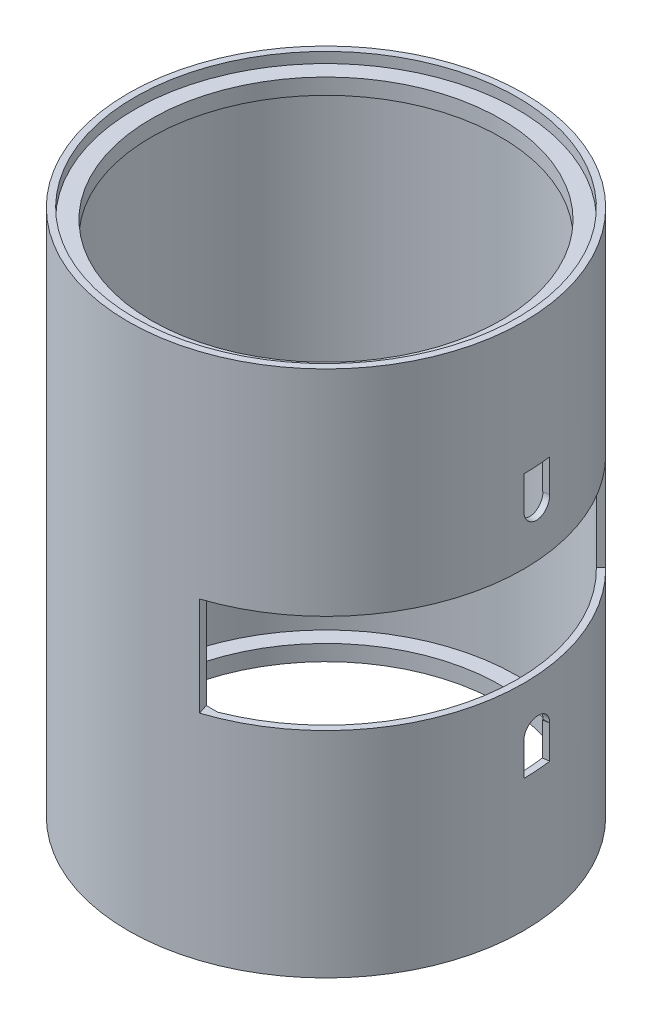
from build123d import *

# Parameters (mm, degrees)
EXTRUDE_11_REACH             = 60.31
EXTRUDE_11_DIRECTION_2_REACH = 60.31
CUT_EXTRUDE_1_DEPTH          = 7.5
CUT_EXTRUDE_1_DEPTH_BACK     = 7.5
CUT_EXTRUDE_2_DEPTH          = 5
CUT_EXTRUDE_START            = 28.688718626
CUT_EXTRUDE_3_DEPTH          = 1.311276176


# Read off the part's stored shape, not the designer's step: 切除-拉伸3
with BuildPart() as part:
    # 草图1 → 旋转1 (revolve)
    with BuildSketch(Plane.XY, mode=Mode.PRIVATE) as revolve_1_sk:
        Polygon((26.5, 38.4), (26.5, 36), (29, 36), (29, 0), (30, 0), (30, 40), (29, 40), (29, 38.4), align=None)
    revolve_1 = revolve(revolve_1_sk.sketch.rotate(Axis((0, 66, 0), (0, -1, 0)), 90), axis=Axis((0, 66, 0), (0, -1, 0)))

    # 镜向1: 旋转1 across plane
    add(revolve_1.mirror(Plane.ZX))

    # 凸台-拉伸11: up to this face of the body (flat: up to its plane)
    extrude_11_end = Plane(part.part.faces().sort_by_distance((0, 36, -27.320243866))[0])
    # 草图11 → 凸台-拉伸11 (add, up to the picked face)
    with BuildSketch(Plane(origin=(0, 0, 0), x_dir=(1, 0, 0), z_dir=(0, 1, 0)), mode=Mode.PRIVATE) as extrude_11_sk1:
        with BuildLine():
            Line((-13.076696831, -27), (13.076696831, -27))
            ThreePointArc((13.076696831, -27), (0, -30), (-13.076696831, -27))
        make_face()
    extrude_11_tool1 = split(extrude(extrude_11_sk1.sketch, amount=EXTRUDE_11_REACH, mode=Mode.PRIVATE), bisect_by=extrude_11_end, keep=Keep.BOTH, mode=Mode.PRIVATE)
    add(extrude_11_tool1.solids().sort_by(Axis((0, 0, 28.205296), (0, 1, 0)))[0])

    # 凸台-拉伸11 direction 2: up to this face of the body (flat: up to its plane)
    extrude_11_direction_2_end = Plane(part.part.faces().sort_by_distance((0, -36, -27.320243866))[0])
    # 草图11 → 凸台-拉伸11 direction 2 (add, up to the picked face)
    with BuildSketch(Plane(origin=(0, 0, 0), x_dir=(1, 0, 0), z_dir=(0, 1, 0)), mode=Mode.PRIVATE) as extrude_11_direction_2_sk1:
        with BuildLine():
            Line((-13.076696831, -27), (13.076696831, -27))
            ThreePointArc((13.076696831, -27), (0, -30), (-13.076696831, -27))
        make_face()
    extrude_11_direction_2_tool1 = split(extrude(extrude_11_direction_2_sk1.sketch, amount=-EXTRUDE_11_DIRECTION_2_REACH, mode=Mode.PRIVATE), bisect_by=extrude_11_direction_2_end, keep=Keep.BOTH, mode=Mode.PRIVATE)
    add(extrude_11_direction_2_tool1.solids().sort_by(Axis((0, 0, 28.205296), (0, -1, 0)))[0])

    # 草图12 → 切除-拉伸1 (cut, two sides: drawn at the far end of the back side and taken through both)
    with BuildSketch(Plane(origin=(0, 0, 0), x_dir=(1, 0, 0), z_dir=(0, 1, 0)).offset(-CUT_EXTRUDE_1_DEPTH_BACK)):
        with BuildLine():
            Line((0, 0), (22.520337054, 22.934948885))
            ThreePointArc((22.520337054, 22.934948885), (31.296937417, -7.32660697), (10, -30.547953473))
            Line((10, -30.547953473), (0, 0))
        make_face()
    extrude(amount=CUT_EXTRUDE_1_DEPTH + CUT_EXTRUDE_1_DEPTH_BACK, mode=Mode.SUBTRACT)

    # Sketch 3D_2 → 切除-拉伸2 (cut)
    with BuildSketch(Plane(origin=(35, 15, -4.993961669), x_dir=(-0.989973390659655, 0, 0.1412539761770484), z_dir=(0, 1, 0))):
        with BuildLine():
            Line((0, 0), (35.354485616, 0))
            Line((35.354485616, 0), (0.330334968, 4.976372773))
            ThreePointArc((0.330334968, 4.976372773), (0.075684949, 2.494126297), (0, 0))
        make_face()
    cut_extrude_2 = extrude(amount=CUT_EXTRUDE_2_DEPTH, mode=Mode.SUBTRACT)

    # 镜向2: 切除-拉伸2 across plane
    add(cut_extrude_2.mirror(Plane.ZX), mode=Mode.SUBTRACT)

    # 切除-拉伸3 outline → 切除-拉伸3 (cut)
    with BuildSketch(Plane.YZ.offset(CUT_EXTRUDE_START)):
        with BuildLine():
            Line((15, -4.237619285), (15, -0.017659399))
            add(Edge.make_bspline(
                [(15, -0.017659399), (12.884666816, -0.017659399), (12.884666816, -2.127639342), (12.884666816, -4.237619285), (15, -4.237619285)],
                knots=[3.141592654, 3.141592654, 3.141592654, 4.71238898, 4.71238898, 6.283185307, 6.283185307, 6.283185307], degree=2, weights=[1, 0.707106781, 1, 0.707106781, 1]))
        make_face()
    cut_extrude_3 = extrude(amount=CUT_EXTRUDE_3_DEPTH, mode=Mode.SUBTRACT)

    # 镜向3: 切除-拉伸3 across plane
    add(cut_extrude_3.mirror(Plane.ZX), mode=Mode.SUBTRACT)


solid = part.part
